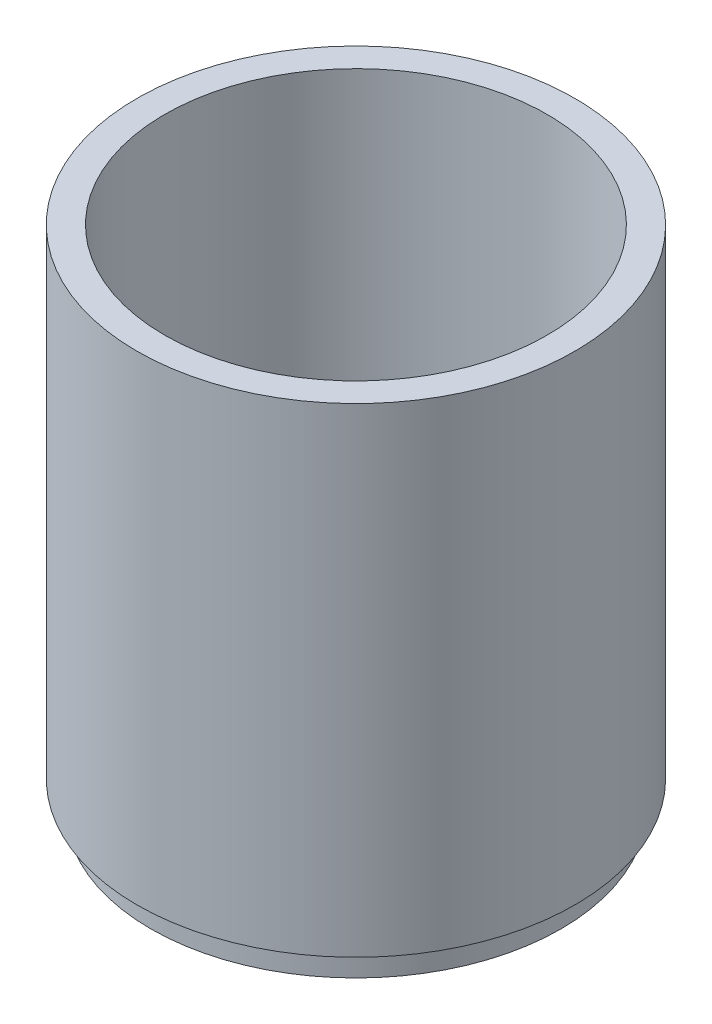
from build123d import *

# Parameters (mm, degrees)
SKETCH1_R           = 7.4
SKETCH1_R_2         = 6.4
BOSS_EXTRUDE1_DEPTH = 1
SKETCH2_R           = 7.9
SKETCH2_R_2         = 6.9
BOSS_EXTRUDE2_DEPTH = 17.3


with BuildPart() as part:
    # Sketch1 → Boss-Extrude1 (new body)
    with BuildSketch(Plane(origin=(0, 0, 0), x_dir=(1, 0, 0), z_dir=(0, 1, 0))):
        Circle(SKETCH1_R)
        Circle(SKETCH1_R_2, mode=Mode.SUBTRACT)
    extrude(amount=BOSS_EXTRUDE1_DEPTH)

    # Sketch2 → Boss-Extrude2 (add)
    with BuildSketch(Plane(origin=(0, 1, 0), x_dir=(1, 0, 0), z_dir=(0, 1, 0))):
        Circle(SKETCH2_R)
        Circle(SKETCH2_R_2, mode=Mode.SUBTRACT)
    extrude(amount=BOSS_EXTRUDE2_DEPTH)


solid = part.part
